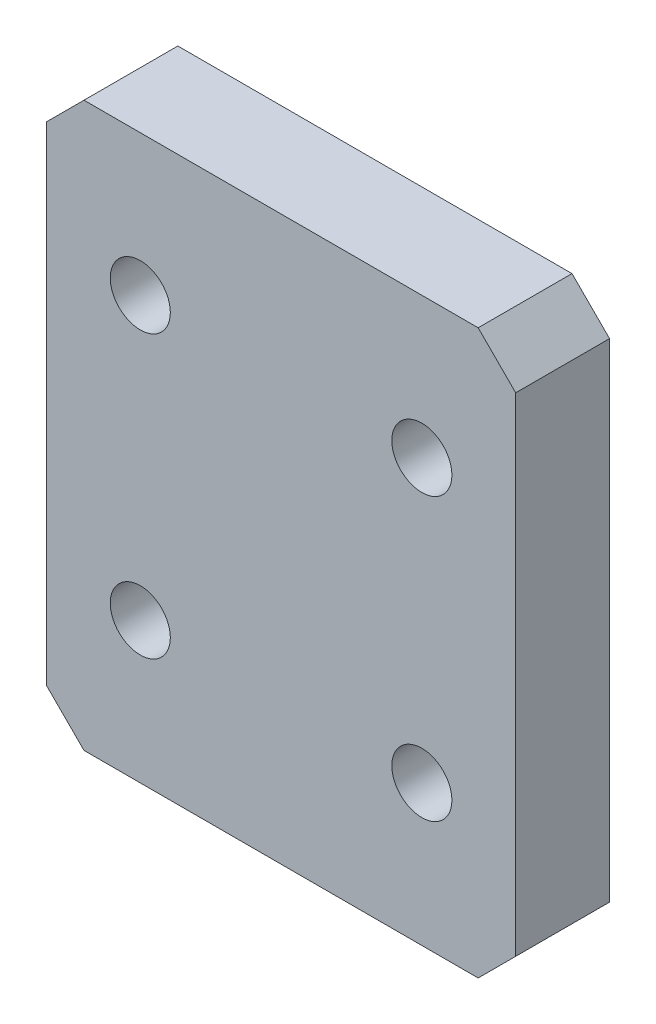
from build123d import *

# Parameters (mm, degrees)
SKETCH_1_W                  = 25
SKETCH_1_H                  = 30
EXTRUDE_1_DEPTH             = 5
SKETCH_4_R                  = 1.6
CUT_EXTRUDE_3_DEPTH         = 21.155644371
PATTERN_LINEAR_1_COUNT      = 2
PATTERN_LINEAR_1_PITCH      = 15
PATTERN_LINEAR_1_COUNT_DIR2 = 2
PATTERN_LINEAR_1_PITCH_DIR2 = 15
CHAMFER_1_SIZE              = 2


with BuildPart() as part:
    # 草圖1 → 填料-伸長1 (new body)
    with BuildSketch(Plane.XY):
        Rectangle(SKETCH_1_W, SKETCH_1_H)
    extrude(amount=EXTRUDE_1_DEPTH)

    # 草圖4 → 除料-伸長3 (cut, through all)
    with BuildSketch(Plane.XY.offset(5)):
        with Locations((-7.5, 7.5)):
            Circle(SKETCH_4_R)
    cut_extrude_3 = extrude(amount=-CUT_EXTRUDE_3_DEPTH, mode=Mode.SUBTRACT)

    # 直線複製排列1: Cut-Extrude 3 2 × 2
    with Locations(*[(i * PATTERN_LINEAR_1_PITCH, -j * PATTERN_LINEAR_1_PITCH_DIR2, 0) for i in range(PATTERN_LINEAR_1_COUNT) for j in range(PATTERN_LINEAR_1_COUNT_DIR2) if (i, j) != (0, 0)]):
        add(cut_extrude_3, mode=Mode.SUBTRACT)

    # 導角1
    chamfer_1_edges = [part.edges().sort_by_distance(p)[0] for p in [
        (12.5, -15, 2.5),
        (-12.5, -15, 2.5),
        (-12.5, 15, 2.5),
        (12.5, 15, 2.5),
    ]]
    chamfer(chamfer_1_edges, length=CHAMFER_1_SIZE)


solid = part.part
